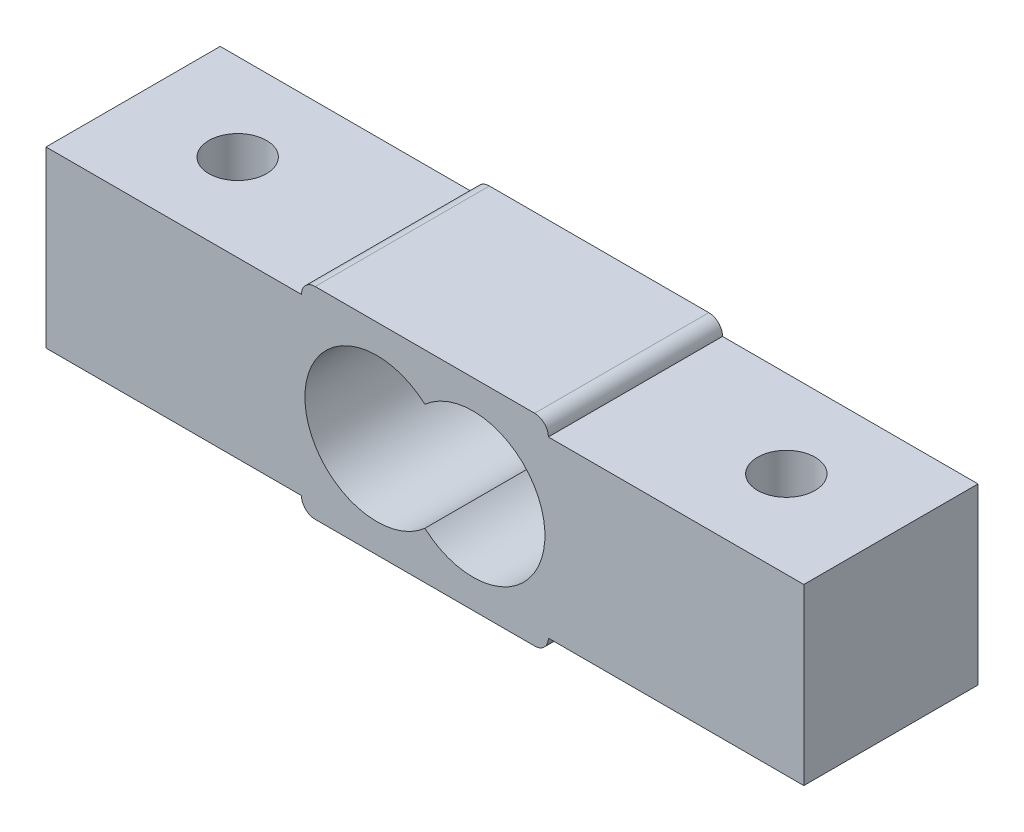
from build123d import *

# Parameters (mm, degrees)
SKETCH1_W             = 55.25
SKETCH1_H             = 12.7
BOSS_EXTRUDE1_DEPTH   = 12.7
M5X0_8_TAPPED_HOLE1_D = 4.2
CUT_EXTRUDE1_DEPTH    = 32.060475286
SKETCH5_W             = 18
SKETCH5_H             = 12.7
BOSS_EXTRUDE2_DEPTH   = 1
FILLET1_R             = 1


with BuildPart() as part:
    # Sketch1 → Boss-Extrude1 (new body)
    with BuildSketch(Plane.XY):
        Rectangle(SKETCH1_W, SKETCH1_H)
    extrude(amount=BOSS_EXTRUDE1_DEPTH)

    # M5x0.8 Tapped Hole1 (through all)
    with Locations(Plane(origin=(-20, 6.35, 6.35), x_dir=(0, 0, 1), z_dir=(0, 1, 0))):
        with Locations((0, 0), (0, 40)):
            Hole(M5X0_8_TAPPED_HOLE1_D / 2)

    # Sketch4 → Cut-Extrude1 (cut, through all)
    with BuildSketch(Plane.XY.offset(12.7)):
        with BuildLine():
            ThreePointArc((0, 3.913118961), (-8.75, 0), (0, -3.913118961))
            ThreePointArc((0, -3.913118961), (8.75, 0), (0, 3.913118961))
        make_face()
    extrude(amount=-CUT_EXTRUDE1_DEPTH, mode=Mode.SUBTRACT)

    # Sketch5 → Boss-Extrude2 (add)
    with BuildSketch(Plane(origin=(0, 6.35, 0), x_dir=(1, 0, 0), z_dir=(0, 1, 0))):
        with Locations((0, -6.35)):
            Rectangle(SKETCH5_W, SKETCH5_H)
    boss_extrude2 = extrude(amount=BOSS_EXTRUDE2_DEPTH)

    # Mirror1: Boss-Extrude2 across plane
    add(boss_extrude2.mirror(Plane.ZX))

    # Fillet1
    fillet1_edges = [part.edges().sort_by_distance(p)[0] for p in [
        (9, -7.35, 6.35),
        (-9, -7.35, 6.35),
        (-9, 7.35, 6.35),
        (9, 7.35, 6.35),
    ]]
    fillet(fillet1_edges, radius=FILLET1_R - 0.0001)  # a hair under: the kernel refuses the full size


solid = part.part
